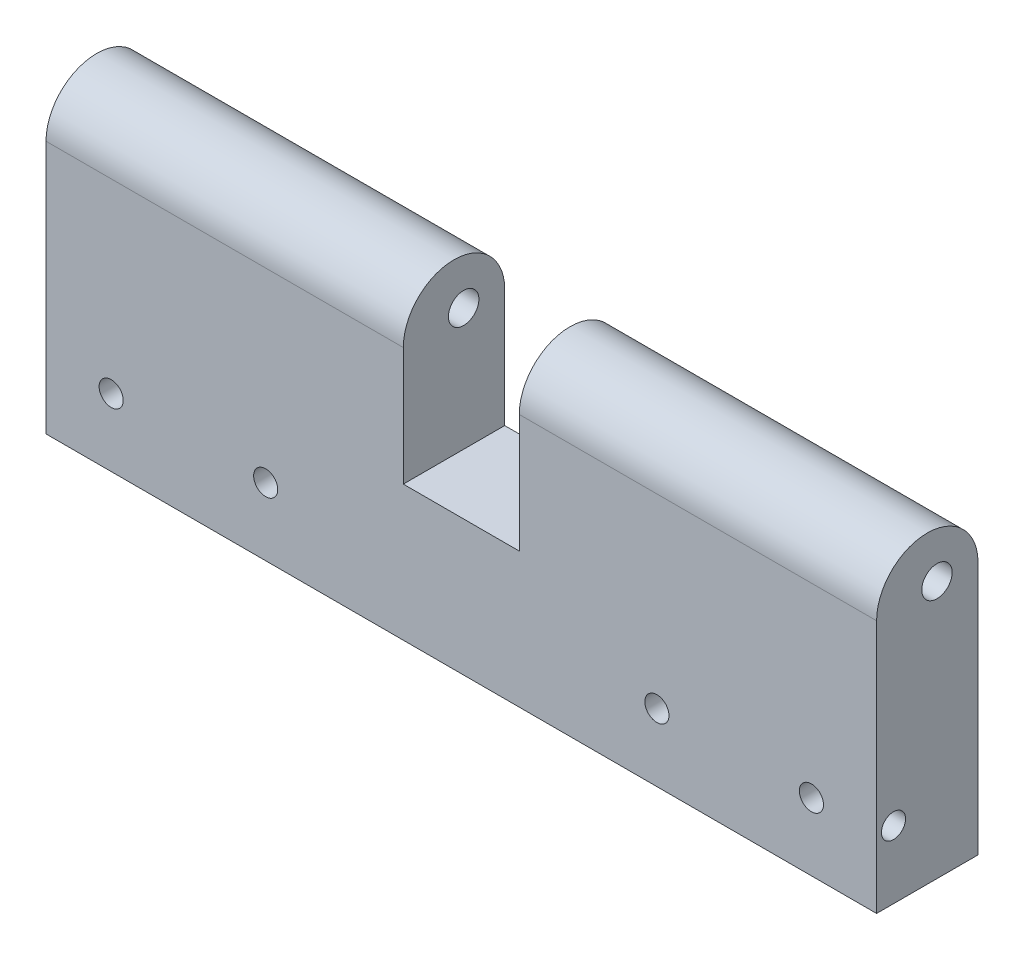
from build123d import *

# Parameters (mm, degrees)
SKETCH_1_W          = 172.02
SKETCH_1_H          = 28
SKETCH_1_R          = 2.5
EXTRUDE_1_DEPTH     = 21
SKETCH_2_W          = 74
SKETCH_2_H          = 21
EXTRUDE_2_DEPTH     = 35
CUT_EXTRUDE_1_DEPTH = 181.091311284
SKETCH_4_R          = 3.15
CUT_EXTRUDE_2_DEPTH = 181.091311284
SKETCH_6_R          = 2.5
CUT_EXTRUDE_3_DEPTH = 8
CUT_EXTRUDE_START   = -8
SKETCH_7_R          = 2.5
CUT_EXTRUDE_4_DEPTH = 8


with BuildPart() as part:
    # 草图1 → 凸台-拉伸1 (new body)
    with BuildSketch(Plane.XY):
        Rectangle(SKETCH_1_W, SKETCH_1_H)
        with Locations((-72.51, 0)):
            Circle(SKETCH_1_R, mode=Mode.SUBTRACT)
        with Locations((-40.51, 0)):
            Circle(SKETCH_1_R, mode=Mode.SUBTRACT)
        with Locations((40.51, 0)):
            Circle(SKETCH_1_R, mode=Mode.SUBTRACT)
        with Locations((72.51, 0)):
            Circle(SKETCH_1_R, mode=Mode.SUBTRACT)
    extrude(amount=EXTRUDE_1_DEPTH)

    # 草图2 → 凸台-拉伸2 (add)
    with BuildSketch(Plane(origin=(0, 14, 0), x_dir=(1, 0, 0), z_dir=(0, 1, 0))):
        with Locations((-49.01, -10.5)):
            Rectangle(SKETCH_2_W, SKETCH_2_H)
        with Locations((49.01, -10.5)):
            Rectangle(SKETCH_2_W, SKETCH_2_H)
    extrude(amount=EXTRUDE_2_DEPTH)

    # 草图3 → 切除-拉伸1 (cut, through all)
    with BuildSketch(Plane(origin=(86.01, 0, 0), x_dir=(0, 0, -1), z_dir=(1, 0, 0))):
        with BuildLine():
            Line((-10.5, 49), (-21, 49))
            Line((-21, 49), (-21, 38.5))
            ThreePointArc((-21, 38.5), (-17.924621202, 45.924621202), (-10.5, 49))
        make_face()
        with BuildLine():
            Line((0, 49), (-10.5, 49))
            ThreePointArc((-10.5, 49), (-3.075378798, 45.924621202), (0, 38.5))
            Line((0, 38.5), (0, 49))
        make_face()
    extrude(amount=-CUT_EXTRUDE_1_DEPTH, mode=Mode.SUBTRACT)

    # 草图4 → 切除-拉伸2 (cut, through all)
    with BuildSketch(Plane(origin=(86.01, 0, 0), x_dir=(0, 0, -1), z_dir=(1, 0, 0))):
        with Locations((-8.500165561, 39.35)):
            Circle(SKETCH_4_R)
    extrude(amount=-CUT_EXTRUDE_2_DEPTH, mode=Mode.SUBTRACT)

    # 草图6 → 切除-拉伸3 (cut)
    with BuildSketch(Plane(origin=(86.01, 0, 0), x_dir=(0, 0, -1), z_dir=(1, 0, 0))):
        with Locations((-17.5, 0)):
            Circle(SKETCH_6_R)
    extrude(amount=-CUT_EXTRUDE_3_DEPTH, mode=Mode.SUBTRACT)

    # 草图7 → 切除-拉伸4 (cut)
    with BuildSketch(Plane.ZY.offset(86.01).offset(CUT_EXTRUDE_START)):
        with Locations((17.5, 0)):
            Circle(SKETCH_7_R)
    extrude(amount=CUT_EXTRUDE_4_DEPTH, mode=Mode.SUBTRACT)


solid = part.part
